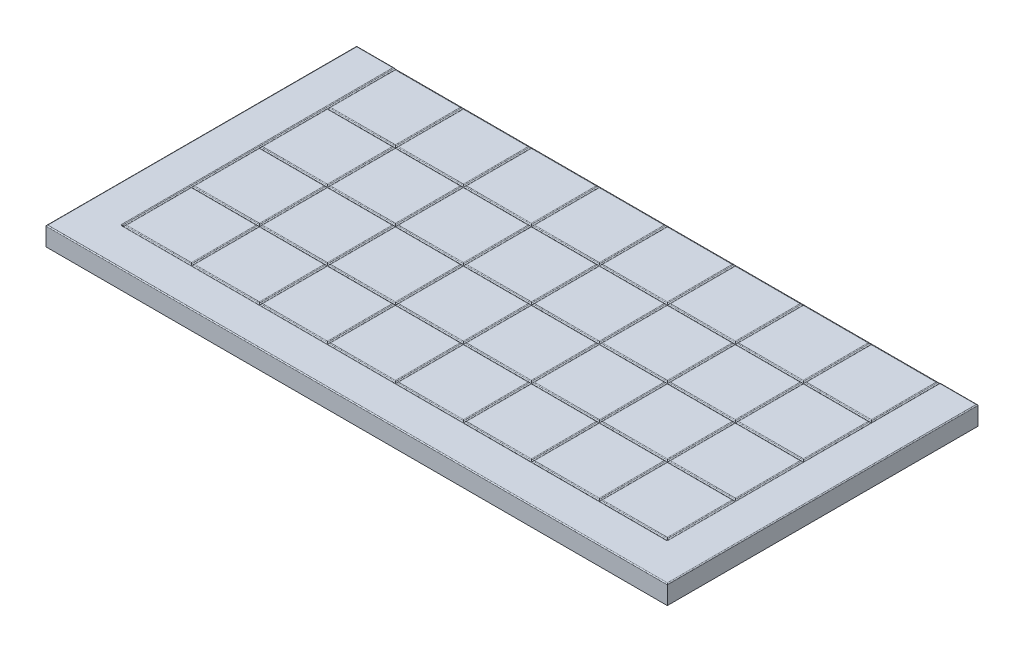
from build123d import *

# Parameters (mm, degrees)
EXTRUDE_1_DEPTH        = 10
SWEEP_1_PROFILE_R      = 0.5
PATTERN_LINEAR_1_COUNT = 9
PATTERN_LINEAR_1_PITCH = 36
SWEEP_2_PROFILE_R      = 0.5
PATTERN_LINEAR_7_COUNT = 5
PATTERN_LINEAR_7_PITCH = 36
FILLET_3_R             = 0.5


with BuildPart() as part:
    # Эскиз1 → Бобышка-Вытянуть1 (new body)
    with BuildSketch(Plane(origin=(0, 0, 0), x_dir=(1, 0, 0), z_dir=(0, 1, 0))):
        Polygon((-144, 164.5), (144, 164.5), (164.5, 164.5), (164.5, 0), (-164.5, 0), (-164.5, 164.5), align=None)
    extrude(amount=-EXTRUDE_1_DEPTH)

    # Вырез-По траектории1: sweep along a path in Эскиз2
    with BuildLine(Plane(origin=(0, 0, 0), x_dir=(1, 0, 0), z_dir=(0, 1, 0))) as sweep_1_path:
        Line((-144, 164.5), (-144, 20.5))
    # Вырез-По траектории1 profile (on start of the path) → Вырез-По траектории1 (sweep, cut)
    with BuildSketch(Plane(origin=(-144, 0, -164.5), x_dir=(1, 0, 0), z_dir=(0, 0, 1))):
        Circle(SWEEP_1_PROFILE_R)
    sweep_1 = sweep(path=sweep_1_path.line, mode=Mode.SUBTRACT)

    # Линейный массив1: Вырез-По траектории1 ×9
    with Locations(*[(i * PATTERN_LINEAR_1_PITCH, 0, 0) for i in range(1, PATTERN_LINEAR_1_COUNT)]):
        add(sweep_1, mode=Mode.SUBTRACT)

    # Вырез-По траектории2: sweep along a path in Эскиз28
    with BuildLine(Plane(origin=(0, 0, 0), x_dir=(1, 0, 0), z_dir=(0, 1, 0))) as sweep_2_path:
        Line((-144, 20.5), (144, 20.5))
    # Вырез-По траектории2 profile (on start of the path) → Вырез-По траектории2 (sweep, cut)
    with BuildSketch(Plane(origin=(-144, 0, -20.5), x_dir=(0, 0, 1), z_dir=(1, 0, 0))):
        Circle(SWEEP_2_PROFILE_R)
    sweep_2 = sweep(path=sweep_2_path.line, mode=Mode.SUBTRACT)

    # Линейный массив7: Вырез-По траектории2 ×5
    with Locations(*[(0, 0, -i * PATTERN_LINEAR_7_PITCH) for i in range(1, PATTERN_LINEAR_7_COUNT)]):
        add(sweep_2, mode=Mode.SUBTRACT)

    # Скругление3
    fillet_3_edges = [part.edges().sort_by_distance(p)[0] for p in [
        (-108.5, 0, -146.5),
        (-107.5, 0, -146.5),
        (-126, 0, -129),
        (-126, 0, -128),
        (-143.5, 0, -146.5),
        (-126, 0, -164),
        (-72.5, 0, -146.5),
        (-71.5, 0, -146.5),
        (-90, 0, -129),
        (-90, 0, -128),
        (-90, 0, -164),
        (-36.5, 0, -146.5),
        (-35.5, 0, -146.5),
        (-54, 0, -129),
        (-54, 0, -128),
        (-54, 0, -164),
        (-0.5, 0, -146.5),
        (0.5, 0, -146.5),
        (-18, 0, -129),
        (-18, 0, -128),
        (-18, 0, -164),
        (71.5, 0, -146.5),
        (72.5, 0, -146.5),
        (54, 0, -129),
        (54, 0, -128),
        (35.5, 0, -146.5),
        (36.5, 0, -146.5),
        (54, 0, -164),
        (18, 0, -129),
        (18, 0, -128),
        (18, 0, -164),
        (35.5, 0, -110.5),
        (36.5, 0, -110.5),
        (18, 0, -93),
        (18, 0, -92),
        (-0.5, 0, -110.5),
        (0.5, 0, -110.5),
        (-18, 0, -93),
        (-18, 0, -92),
        (-36.5, 0, -110.5),
        (-35.5, 0, -110.5),
        (-54, 0, -93),
        (-54, 0, -92),
        (-72.5, 0, -110.5),
        (-71.5, 0, -110.5),
        (-90, 0, -93),
        (-90, 0, -92),
        (-108.5, 0, -110.5),
        (-107.5, 0, -110.5),
        (-72.5, 0, -74.5),
        (-71.5, 0, -74.5),
        (-90, 0, -57),
        (-90, 0, -56),
        (-108.5, 0, -74.5),
        (-107.5, 0, -74.5),
        (-36.5, 0, -74.5),
        (-35.5, 0, -74.5),
        (-54, 0, -57),
        (-54, 0, -56),
        (-0.5, 0, -74.5),
        (0.5, 0, -74.5),
        (-18, 0, -57),
        (-18, 0, -56),
        (35.5, 0, -74.5),
        (36.5, 0, -74.5),
        (18, 0, -57),
        (18, 0, -56),
        (107.5, 0, -74.5),
        (108.5, 0, -74.5),
        (90, 0, -57),
        (90, 0, -56),
        (71.5, 0, -74.5),
        (72.5, 0, -74.5),
        (90, 0, -93),
        (90, 0, -92),
        (54, 0, -57),
        (54, 0, -56),
        (54, 0, -93),
        (54, 0, -92),
        (71.5, 0, -110.5),
        (72.5, 0, -110.5),
        (107.5, 0, -110.5),
        (108.5, 0, -110.5),
        (90, 0, -129),
        (90, 0, -128),
        (107.5, 0, -146.5),
        (108.5, 0, -146.5),
        (90, 0, -164),
        (143.5, 0, -146.5),
        (126, 0, -128),
        (126, 0, -129),
        (126, 0, -164),
        (143.5, 0, -110.5),
        (126, 0, -92),
        (126, 0, -93),
        (143.5, 0, -74.5),
        (126, 0, -56),
        (126, 0, -57),
        (143.5, 0, -38.5),
        (126, 0, -21),
        (107.5, 0, -38.5),
        (108.5, 0, -38.5),
        (90, 0, -21),
        (71.5, 0, -38.5),
        (72.5, 0, -38.5),
        (54, 0, -21),
        (35.5, 0, -38.5),
        (36.5, 0, -38.5),
        (18, 0, -21),
        (-0.5, 0, -38.5),
        (0.5, 0, -38.5),
        (-18, 0, -21),
        (-36.5, 0, -38.5),
        (-35.5, 0, -38.5),
        (-54, 0, -21),
        (-72.5, 0, -38.5),
        (-71.5, 0, -38.5),
        (-90, 0, -21),
        (-108.5, 0, -38.5),
        (-107.5, 0, -38.5),
        (-126, 0, -21),
        (-143.5, 0, -38.5),
        (-126, 0, -57),
        (-126, 0, -56),
        (144, 0, -20.25),
        (144.25, 0, -20.5),
        (144.5, 0, -92.5),
        (154.5, 0, -164.5),
        (164.5, 0, -82.25),
        (0, 0, 0),
        (-164.5, 0, -82.25),
        (-154.5, 0, -164.5),
        (-144.5, 0, -92.5),
        (-144.25, 0, -20.5),
        (-144, 0, -20.25),
        (0, 0, -20),
        (-126, 0, -93),
        (-126, 0, -92),
        (-143.5, 0, -110.5),
        (-143.5, 0, -74.5),
    ]]
    fillet(fillet_3_edges, radius=FILLET_3_R - 0.0001)  # a hair under: the kernel refuses the full size


solid = part.part
